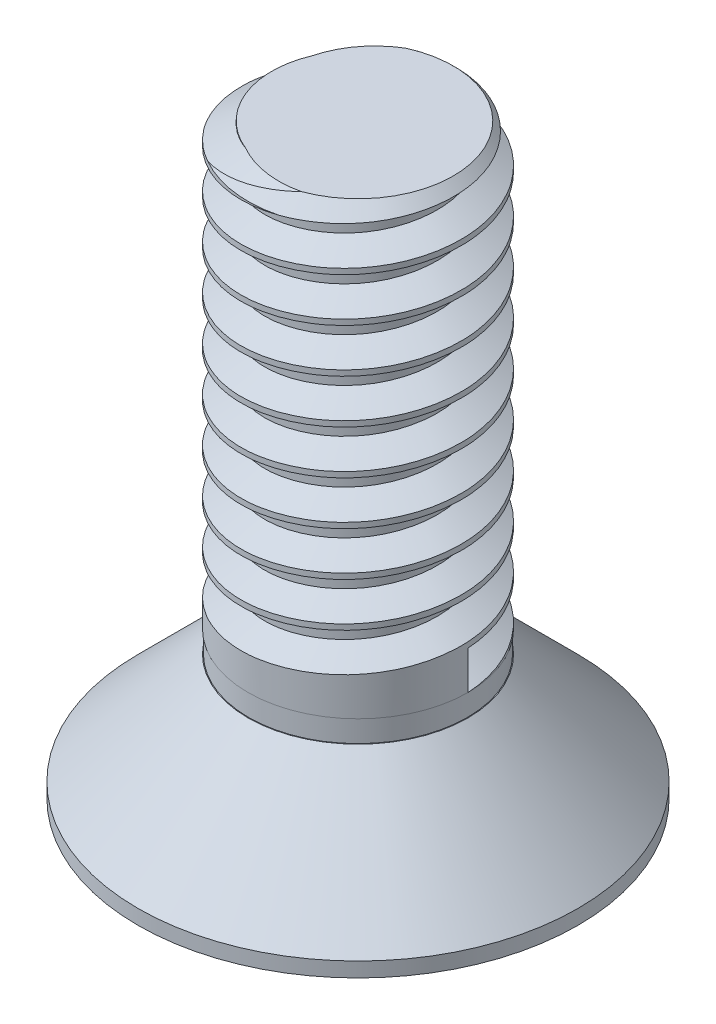
from build123d import *

# Parameters (mm, degrees)
CHAMFER1_SIZE   = 0.2
HEX_DEPTH_DEPTH = 1.2
THREAD_M3_PITCH = 0.6


# Read off the part's stored shape, not the designer's step: hex corner cut
with BuildPart() as part:
    # Sketch1 → Revolve1 (revolve)
    with BuildSketch(Plane.XY, mode=Mode.PRIVATE) as revolve1_sk:
        Polygon((0, -1.873883868), (-3, -1.873883868), (-3, -1.673883868), (-1.5, -0.173883868), (-1.49, -0.173883868), (-1.49, 0.126116132), (-1.5, 0.126116132), (-1.5, 6.126116132), (0, 6.126116132), align=None)
    revolve(revolve1_sk.sketch.rotate(Axis((0, 0, 0), (0, 1, 0)), 270), axis=Axis((0, 0, 0), (0, 1, 0)))

    # Chamfer1
    chamfer1_edges = [part.edges().sort_by_distance(p)[0] for p in [
        (0, 6.126116132, 1.5),
    ]]
    chamfer(chamfer1_edges, length=CHAMFER1_SIZE)

    # Sketch2 → hex depth (cut)
    with BuildSketch(Plane.XZ.offset(1.873883868)):
        Polygon((1.154700538, 0), (0.577350269, 1), (-0.577350269, 1), (-1.154700538, 0), (-0.577350269, -1), (0.577350269, -1), align=None)
    extrude(amount=-HEX_DEPTH_DEPTH, mode=Mode.SUBTRACT)

    # hex corner cut outline → hex corner cut (revolve, cut)
    with BuildSketch(Plane.XY):
        Polygon((1.154700587, -1.87388393), (0.999999316, -1.673882983), (0.999871021, -1.673717121), (0.999871021, -1.8738844), align=None)
    revolve(axis=Axis((0, 0, 0), (0, 1, 0)), mode=Mode.SUBTRACT)

    # thread M3: the profile of Thread Profile2 profile screwed along a right-hand helix of 10 turns, 6 arcs to a turn; built about Z, then put on its axis
    thread_m3_z = Axis((0, 0, 0), (0, 0, 1))
    thread_m3_corners = [(1.5003, 0, -0.000173205), (1.5003, 0, 0.525173204), (1.175240475, 0, 0.337499999), (1.175240475, 0, 0.187499999)]
    with BuildLine(mode=Mode.PRIVATE) as thread_m3_profile:
        Line(thread_m3_corners[0], thread_m3_corners[1])
        Line(thread_m3_corners[1], thread_m3_corners[2])
        Line(thread_m3_corners[2], thread_m3_corners[3])
        Line(thread_m3_corners[3], thread_m3_corners[0])
    thread_m3_cap = Face(thread_m3_profile.wire())
    thread_m3_turn_angles = [0, 30, 60, 90, 120, 150, 180, 210, 240, 270, 300, 330, 360]
    thread_m3_turn_weights = [1, 0.8660254037844387, 1, 0.8660254037844387, 1, 0.8660254037844387, 1, 0.8660254037844387, 1, 0.8660254037844387, 1, 0.8660254037844387, 1]
    thread_m3_turn_rails = [Edge.make_bspline([Vector(p[0], p[1], 0).rotate(thread_m3_z, thread_m3_turn_angles[k]) / thread_m3_turn_weights[k] + Vector(0, 0, p[2] + THREAD_M3_PITCH * thread_m3_turn_angles[k] / 360) for k in range(13)], [0, 0, 0, 1, 1, 2, 2, 3, 3, 4, 4, 5, 5, 6, 6, 6], 2, thread_m3_turn_weights) for p in thread_m3_corners]
    thread_m3_turn_sides = [Face.make_surface_from_curves(thread_m3_turn_rails[p[0]], thread_m3_turn_rails[p[1]]) for p in [(0, 1), (1, 2), (2, 3), (3, 0)]]
    thread_m3 = Plane(origin=(0, 0.126116132, 0), x_dir=(1, 0, 0), z_dir=(0, 1, 0)) * Solid(Shell([*[p.moved(Location((0, 0, THREAD_M3_PITCH * i))) for i in range(10) for p in thread_m3_turn_sides], thread_m3_cap, thread_m3_cap.rotate(thread_m3_z, 3600).moved(Location((0, 0, THREAD_M3_PITCH * 3600 / 360)))]))
    add(thread_m3, mode=Mode.SUBTRACT)


solid = part.part
